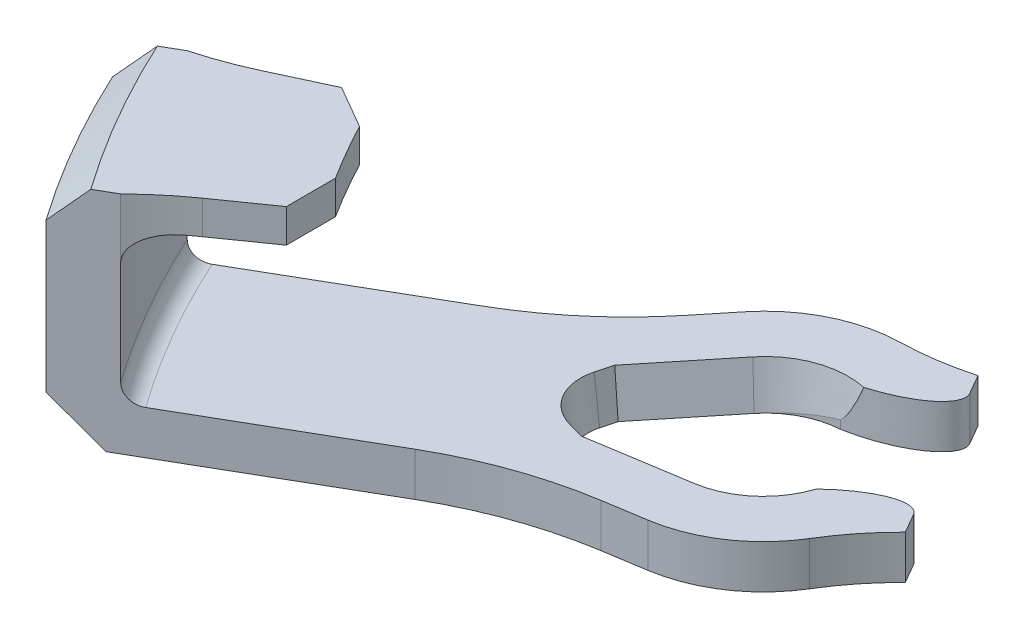
from build123d import *

# Parameters (mm, degrees)
EXTRUDE_1_DEPTH     = 2.4
EXTRUDE_1_DRAFT     = 10
EXTRUDE_2_DEPTH     = 12.4
EXTRUDE_4_DEPTH     = 2.4
EXTRUDE_START       = -1.84
EXTRUDE_3_DEPTH     = 1.84
CHAMFER_1_SIZE      = 2.4
FILLET_3_R          = 1
FILLET_4_R          = 19
CHAMFER_2_SIZE      = 1.5
CHAMFER_3_SIZE      = 1.5
FILLET_5_SIZE       = 2.4
FILLET_5_SIZE_2     = 1.4
FILLET_8_R          = 15
CUT_EXTRUDE_2_DEPTH = 5
FILLET_6_DEPTH      = 3
FILLET_START        = -1
FILLET_7_DEPTH      = 4
CHAMFER_4_SIZE      = 1.8
FILLET_9_R          = 22


with BuildPart() as part:
    # 草图1 → 凸台-拉伸1 (with draft: the straight prism first)
    with BuildSketch(Plane(origin=(0, 0, 0), x_dir=(1, 0, 0), z_dir=(0, 1, 0))):
        with BuildLine():
            Line((-8, -10.392304845), (-13, -1.732050808))
            Line((-13, -1.732050808), (-21.967816979, -6.909622355))
            Line((-21.967816979, -6.909622355), (-22.707395472, -6.711455524))
            ThreePointArc((-22.707395472, -6.711455524), (-27.045667208, -6.825066474), (-30.622176838, -9.283132374))
            Line((-30.622176838, -9.283132374), (-34.43427487, -13.990668154))
            Line((-34.43427487, -13.990668154), (-34.611399325, -14.209398026))
            Line((-34.611399325, -14.209398026), (-48.418968561, -22.181201841))
            ThreePointArc((-48.418968561, -22.181201841), (-46.122680686, -26.62894211), (-43.418968561, -30.841455878))
            Line((-43.418968561, -30.841455878), (-29.611399325, -22.869652063))
            Line((-29.611399325, -22.869652063), (-29.333411472, -22.825622721))
            Line((-29.333411472, -22.825622721), (-23.350516885, -21.878016874))
            ThreePointArc((-23.350516885, -21.878016874), (-19.433514554, -20.009701627), (-17.165988715, -16.309453567))
            Line((-17.165988715, -16.309453567), (-16.967816979, -15.569876393))
            Line((-16.967816979, -15.569876393), (-8, -10.392304845))
        make_face()
        with BuildLine():
            Line((-27.917710858, -11.473169763), (-31.264303283, -15.605855609))
            Line((-31.264303283, -15.605855609), (-31.480162481, -16.411447438))
            ThreePointArc((-31.480162481, -16.411447438), (-31.264379417, -18.05049777), (-29.952811807, -19.056896659))
            Line((-29.952811807, -19.056896659), (-29.147219046, -19.27275307))
            Line((-29.147219046, -19.27275307), (-23.894912088, -18.440861966))
            ThreePointArc((-23.894912088, -18.440861966), (-21.762087, -17.423555776), (-20.527408298, -15.408754734))
            Line((-20.527408298, -15.408754734), (-19.958845574, -13.286877913))
            ThreePointArc((-19.958845574, -13.286877913), (-20.174626779, -11.647826039), (-21.486196869, -10.641428268))
            Line((-21.486196869, -10.641428268), (-23.608077089, -10.07287972))
            ThreePointArc((-23.608077089, -10.07287972), (-25.97028529, -10.134742248), (-27.917710858, -11.473169763))
        make_face(mode=Mode.SUBTRACT)
    extrude(amount=EXTRUDE_1_DEPTH)
    # 凸台-拉伸1: the draft: its side faces are tilted about the plane it starts from
    extrude_1_sides = [part.faces().sort_by_distance(p)[0] for p in [
        (-26.480958105, 1.2, 22.373834469),
        (-29.59100707, 1.2, 13.539512686),
        (-31.372232882, 1.2, 16.008651523),
        (-31.264379417, 1.2, 18.05049777),
        (-29.550015427, 1.2, 19.164824864),
        (-26.521065567, 1.2, 18.856807518),
        (-21.762087, 1.2, 17.423555776),
        (-20.243126936, 1.2, 14.347816323),
        (-20.174626779, 1.2, 11.647826039),
        (-22.547136979, 1.2, 10.357153994),
        (-25.97028529, 1.2, 10.134742248),
        (-46.122680686, 1.2, 26.62894211),
        (-41.515183943, 1.2, 18.195299933),
        (-32.616788082, 1.2, 11.7462652),
        (-27.045667208, 1.2, 6.825066474),
        (-22.337606226, 1.2, 6.810538939),
        (-17.48390849, 1.2, 4.320836581),
        (-10.5, 1.2, 6.062177826),
        (-12.48390849, 1.2, 12.981090619),
        (-17.066902847, 1.2, 15.93966498),
        (-36.515183943, 1.2, 26.855553971),
        (-19.433514554, 1.2, 20.009701627),
    ]]
    draft(extrude_1_sides, Plane(origin=(0, 0, 0), x_dir=(1, 0, 0), z_dir=(0, 1, 0)), EXTRUDE_1_DRAFT)



with BuildPart() as body_2:
    # 草图3 → 凸台-拉伸2 (new body)
    with BuildSketch(Plane.XZ):
        with BuildLine():
            Line((-43.418968561, 30.841455878), (-46.027952282, 32.347753332))
            ThreePointArc((-46.027952282, 32.347753332), (-48.720756898, 28.12894211), (-51.027952282, 23.687499294))
            Line((-51.027952282, 23.687499294), (-48.418968561, 22.181201841))
            ThreePointArc((-48.418968561, 22.181201841), (-46.122680686, 26.62894211), (-43.418968561, 30.841455878))
        make_face()
    extrude(amount=-EXTRUDE_2_DEPTH)


with BuildPart() as part_1:
    add(part.part)

    add(body_2.part)  # 凸台-拉伸4 merges body 2
    # 草图2 → 凸台-拉伸4 (add)
    with BuildSketch(Plane.XZ):
        with BuildLine():
            Line((-13, 1.732050808), (-8, 10.392304845))
            Line((-8, 10.392304845), (-16.967816979, 15.569876393))
            Line((-16.967816979, 15.569876393), (-17.165988715, 16.309453567))
            ThreePointArc((-17.165988715, 16.309453567), (-19.433514554, 20.009701627), (-23.350516885, 21.878016874))
            Line((-23.350516885, 21.878016874), (-29.611399325, 22.869652063))
            Line((-29.611399325, 22.869652063), (-43.418968561, 30.841455878))
            ThreePointArc((-43.418968561, 30.841455878), (-46.122680686, 26.62894211), (-48.418968561, 22.181201841))
            Line((-48.418968561, 22.181201841), (-34.611399325, 14.209398026))
            Line((-34.611399325, 14.209398026), (-30.622176838, 9.283132374))
            ThreePointArc((-30.622176838, 9.283132374), (-27.045667208, 6.825066474), (-22.707395472, 6.711455524))
            Line((-22.707395472, 6.711455524), (-21.967816979, 6.909622355))
            Line((-21.967816979, 6.909622355), (-13, 1.732050808))
        make_face()
        Polygon((-28.267922288, 9.695660603), (-32.994912051, 15.569876392), (-31.812956682, 19.594100966), (-26.346816011, 20.919608689), (-19.040272004, 17.121163853), (-18.489608424, 9.956624946), (-26.72941961, 8.295337377), align=None, mode=Mode.SUBTRACT)
    extrude(amount=-EXTRUDE_4_DEPTH)

    # 草图4 → 凸台-拉伸3 (add)
    with BuildSketch(Plane(origin=(0, 12.4, 0), x_dir=(1, 0, 0), z_dir=(0, 1, 0)).offset(EXTRUDE_START)):
        with BuildLine():
            Line((-41.050551196, -19.055926389), (-51.027952282, -23.687499294))
            ThreePointArc((-51.027952282, -23.687499294), (-48.720756898, -28.12894211), (-46.027952282, -32.347753332))
            Line((-46.027952282, -32.347753332), (-37.028191944, -26.02285698))
            ThreePointArc((-37.028191944, -26.02285698), (-39.194477456, -22.62894211), (-41.050551196, -19.055926389))
        make_face()
    extrude(amount=EXTRUDE_3_DEPTH)

    # 倒角1
    chamfer_1_edges = [part_1.edges().sort_by_distance(p)[0] for p in [
        (-48.720756898, 0, 28.12894211),
    ]]
    chamfer(chamfer_1_edges, length=CHAMFER_1_SIZE)

    # 圆角3
    fillet_3_edges = [part_1.edges().sort_by_distance(p)[0] for p in [
        (-46.122680686, 2.4, 26.62894211),
    ]]
    fillet(fillet_3_edges, radius=FILLET_3_R)

    # 圆角4
    # the kernel refuses this fillet: 19 mm, written as the material it adds along each edge
    with BuildSketch(Plane(origin=(-43.57347219, 12.4, 30.6227816), x_dir=(0.577045376166988, 0, 0.8167120874851181), z_dir=(0, -1, 0))) as fillet_4_piece_1:
        with BuildLine():
            CenterArc((19.007931444, -3.131386572), FILLET_4_R, 170.513813317, 9.63021169)
            Line((0.007991472, -3.179147023), (0, 0))
            ThreePointArc((0, 0), (0.133874766, 0.000168261), (0.267749531, 0))
        make_face()
    extrude(amount=1.84)
    with BuildSketch(Plane(origin=(-48.306842895, 12.4, 22.424343047), x_dir=(-0.4187707272566132, 0, -0.908091998639437), z_dir=(0, -1, 0))) as fillet_4_piece_2:
        with BuildLine():
            CenterArc((19.007931444, 3.131386572), FILLET_4_R, 179.855974993, 9.63021169)
            Line((0.007991472, 3.179147023), (0, 0))
            ThreePointArc((0, 0), (0.133874766, -0.000168261), (0.267749531, 0))
        make_face()
    extrude(amount=1.84)

    # 倒角2
    # the kernel refuses this chamfer: 2.14222201, 1.5 mm, written as the material it takes off along each edge
    with BuildSketch(Plane(origin=(-41.050551196, 4.828583957, 19.055926389), x_dir=(-0.9070364623462953, 0, 0.4210520822586176), z_dir=(0, 1, 0))) as chamfer_2_piece_1:
        with BuildLine():
            Line((CHAMFER_2_SIZE, 0), (-0.054482274, 2.220030761))
            ThreePointArc((-0.054482274, 2.220030761), (-0.014513006, 1.146056403), (0, 0))
            Line((0, 0), (CHAMFER_2_SIZE, 0))
        make_face()
    extrude(amount=13.302832086, mode=Mode.SUBTRACT)

    # 倒角3
    # the kernel refuses this chamfer: 2.14222201, 1.5 mm, written as the material it takes off along each edge
    with BuildSketch(Plane(origin=(-37.028191944, 4.828583957, 26.02285698), x_dir=(-0.5547448997341907, 0, -0.8320204902638533), z_dir=(0, 1, 0))) as chamfer_3_piece_1:
        with BuildLine():
            Line((2.220699191, 0), (-CHAMFER_3_SIZE * 0.0245338379121, CHAMFER_3_SIZE * 0.999699000098))
            Line((-CHAMFER_3_SIZE * 0.0245338379121, CHAMFER_3_SIZE * 0.999699000098), (0, 0))
            ThreePointArc((0, 0), (1.1460675, 0.013608524), (2.220699191, 0))
        make_face()
    extrude(amount=13.302832086, mode=Mode.SUBTRACT)

    # 圆角5
    # a fillet whose section is not a circle: 2.4, 1.4 mm, written as the material it adds along each edge
    with BuildSketch(Plane(origin=(0, 10.56, 0), x_dir=(-0.8181600307253523, 0, 0.5749905774214832), z_dir=(0.5749905774214832, 0, 0.8181600307253523))) as fillet_5_piece_1:
        with BuildLine():
            Bezier((53.25788422 - FILLET_5_SIZE, 0), (53.25788422, 0), (53.25788422, FILLET_5_SIZE_2), weights=[1, 0.707106781, 1])
            Line((53.25788422, FILLET_5_SIZE_2), (53.25788422, 0))
            Line((53.25788422, 0), (53.25788422 - FILLET_5_SIZE, 0))
        make_face()
    revolve(axis=Axis((0, 10.56, 0), (0, -1, 0)), revolution_arc=10.197944658)
    with BuildSketch(Plane(origin=(1.03e-07, 10.56, -7.3e-08), x_dir=(-0.8181600307218722, 0, 0.574990577426435), z_dir=(-0.574990577426435, 0, -0.8181600307218722))) as fillet_5_piece_2_section:
        with BuildLine():
            Bezier((53.257884346 - FILLET_5_SIZE, 0), (53.257884346, 0), (53.257884346, -FILLET_5_SIZE_2), weights=[1, 0.707106781, 1])
            Line((53.257884346, -FILLET_5_SIZE_2), (53.257884346, 0))
            Line((53.257884346, 0), (53.257884346 - FILLET_5_SIZE, 0))
        make_face()
    fillet_5_piece_2 = revolve(axis=Axis((1.03e-07, 10.56, -7.3e-08), (0, 1, 0)), revolution_arc=6.742956788, mode=Mode.PRIVATE)
    fillet_5_piece_2 = fillet_5_piece_2 - Plane(origin=(-30.047591975, 10.56, 44.339836826), x_dir=(0.5770453761670518, 0, 0.8167120874850732), z_dir=(0, 1, 0)) * Cylinder(19, 214, mode=Mode.PRIVATE)
    add(fillet_5_piece_2)
    with BuildSketch(Plane(origin=(1.14e-07, 10.56, -5.3e-08), x_dir=(-0.9070364623485727, 0, 0.4210520822537116), z_dir=(0.4210520822537116, 0, 0.9070364623485727))) as fillet_5_piece_3_section:
        with BuildLine():
            Bezier((53.257884346 - FILLET_5_SIZE, 0), (53.257884346, 0), (53.257884346, FILLET_5_SIZE_2), weights=[1, 0.707106781, 1])
            Line((53.257884346, FILLET_5_SIZE_2), (53.257884346, 0))
            Line((53.257884346, 0), (53.257884346 - FILLET_5_SIZE, 0))
        make_face()
    fillet_5_piece_3 = revolve(axis=Axis((1.14e-07, 10.56, -5.3e-08), (0, -1, 0)), revolution_arc=6.742956788, mode=Mode.PRIVATE)
    fillet_5_piece_3 = fillet_5_piece_3 - Plane(origin=(-53.423221079, 10.56, 3.85205956), x_dir=(-0.41877072725709835, 0, -0.9080919986392134), z_dir=(0, 1, 0)) * Cylinder(19, 214, mode=Mode.PRIVATE)
    add(fillet_5_piece_3)

    # 圆角8
    fillet_8_edges = [part_1.edges().sort_by_distance(p)[0] for p in [
        (-16.967816979, 1.2, 15.569876393),
        (-21.967816979, 1.2, 6.909622355),
    ]]
    fillet(fillet_8_edges, radius=FILLET_8_R)

    # 草图5 → 切除-拉伸2 (cut)
    with BuildSketch(Plane.XZ):
        with BuildLine():
            Line((-29.147219046, 19.27275307), (-31.264303283, 15.605855609))
            Line((-31.264303283, 15.605855609), (-27.917710858, 11.473169763))
            ThreePointArc((-27.917710858, 11.473169763), (-26.519580592, 10.33421548), (-24.781854923, 9.852245982))
            ThreePointArc((-24.781854923, 9.852245982), (-22.061802465, 9.586923289), (-19.411053684, 8.921632073))
            Line((-19.411053684, 8.921632073), (-21.155274081, 5.900553727))
            Line((-21.155274081, 5.900553727), (-15.208253994, -4.420406035))
            Line((-15.208253994, -4.420406035), (0.192169605, 10.177783302))
            Line((0.192169605, 10.177783302), (-15.687666464, 15.370727914))
            Line((-15.687666464, 15.370727914), (-17.431886861, 12.349649567))
            ThreePointArc((-17.431886861, 12.349649567), (-19.333420345, 14.312619743), (-20.923222766, 16.535592924))
            ThreePointArc((-20.923222766, 16.535592924), (-22.209483528, 17.799522767), (-23.894912088, 18.440861966))
            Line((-23.894912088, 18.440861966), (-29.147219046, 19.27275307))
        make_face()
    extrude(amount=-CUT_EXTRUDE_2_DEPTH, mode=Mode.SUBTRACT)

    # 圆角6: read off the stored shape, not the designer's step
    # 圆角6 outline → 圆角6 (cut)
    with BuildSketch(Plane(origin=(0, 0, 0), x_dir=(1, 0, 0), z_dir=(0, 1, 0))):
        with BuildLine():
            Line((-19.411053684, -8.921632073), (-20.538770468, -6.968369307))
            add(Edge.make_bspline(
                [(-20.538770468, -6.968369307), (-19.421581423, -8.903397494), (-24.781854923, -9.852245982)],
                knots=[0, 0, 0, 1, 1, 1], degree=2, weights=[1, 0.573849647, 1]))
            ThreePointArc((-24.781854923, -9.852245982), (-22.061802466, -9.586923289), (-19.411053684, -8.921632073))
        make_face()
    extrude(amount=FILLET_6_DEPTH, mode=Mode.SUBTRACT)

    # 圆角7: read off the stored shape, not the designer's step
    # 圆角7 outline → 圆角7 (cut)
    with BuildSketch(Plane(origin=(0, 0, 0), x_dir=(1, 0, 0), z_dir=(0, 1, 0)).offset(FILLET_START)):
        with BuildLine():
            ThreePointArc((-17.431886861, -12.349649567), (-19.333420346, -14.312619744), (-20.923222767, -16.535592926))
            add(Edge.make_bspline(
                [(-20.923222767, -16.535592926), (-17.421359117, -12.367884155), (-16.304170077, -14.302912333)],
                knots=[0, 0, 0, 1, 1, 1], degree=2, weights=[1, 0.573849648, 1]))
            Line((-16.304170077, -14.302912333), (-17.431886861, -12.349649567))
        make_face()
    extrude(amount=FILLET_7_DEPTH, mode=Mode.SUBTRACT)

    # 倒角4
    chamfer_4_edges = [part_1.edges().sort_by_distance(p)[0] for p in [
        (-48.720756898, 12.4, 28.12894211),
    ]]
    chamfer(chamfer_4_edges, length=CHAMFER_4_SIZE)

    # 圆角9
    fillet_9_edges = [part_1.edges().sort_by_distance(p)[0] for p in [
        (-34.611399325, 1.2, 14.209398026),
        (-29.611399325, 1.2, 22.869652063),
    ]]
    fillet(fillet_9_edges, radius=FILLET_9_R)


solid = part_1.part
